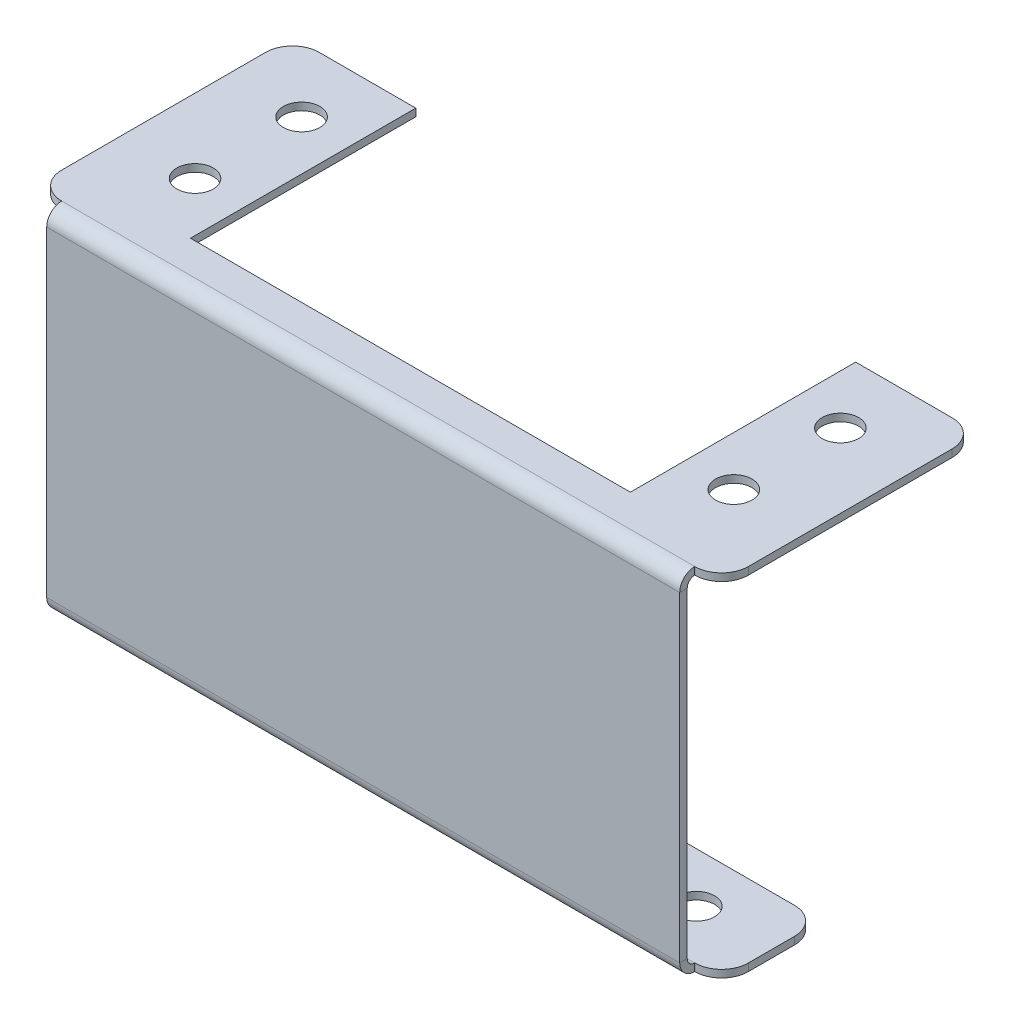
from build123d import *

# Parameters (mm, degrees)
SKETCH4_W                    = 64
SKETCH4_H                    = 24
BASE_FLANGE2_DEPTH           = 0.7
CUT_EXTRUDE1_REACH           = 36.183
SKETCH7_W                    = 41
SKETCH7_H                    = 21
CUT_EXTRUDE2_REACH           = 36.183
SKETCH8_R                    = 1.7
EDGE_FLANGE1_DEPTH           = 59
EDGE_FLANGE2_STRIP_W         = 4.2
EDGE_FLANGE2_STRIP_H         = 0.7
EDGE_FLANGE2_STRIP_CUT_DEPTH = 59
EDGE_FLANGE2_DEPTH           = 59
SKETCH16_W                   = 2.5
SKETCH16_H                   = 9.3
TAB1_DEPTH                   = 0.7
CUT_EXTRUDE3_REACH           = 49.197
SKETCH15_R                   = 1.7
BREAK_CORNER1_START          = -32.7
BREAK_CORNER1_DEPTH          = 32.7
BREAK_CORNER1_2_DEPTH        = 0.7


# Read off the part's stored shape, not the designer's step: Break-Corner1
# Sheet-metal steps are written as plain solids
with BuildPart() as part:
    # Sketch4 → Base-Flange2 (new body)
    with BuildSketch(Plane(origin=(0, 0, 0), x_dir=(1, 0, 0), z_dir=(0, 1, 0))):
        Rectangle(SKETCH4_W, SKETCH4_H)
    extrude(amount=-BASE_FLANGE2_DEPTH)

    # Sketch7 → Cut-Extrude1 (cut, up to next)
    with BuildSketch(Plane(origin=(0, 0, 0), x_dir=(1, 0, 0), z_dir=(0, 1, 0)), mode=Mode.PRIVATE) as cut_extrude1_sk1:
        with Locations((0, 1.5)):
            Rectangle(SKETCH7_W, SKETCH7_H)
    cut_extrude1_tool1 = extrude(cut_extrude1_sk1.sketch, amount=-CUT_EXTRUDE1_REACH, mode=Mode.PRIVATE) & part.part
    add(cut_extrude1_tool1.solids().sort_by_distance((0, 0, -1.5))[0], mode=Mode.SUBTRACT)

    # Sketch8 → Cut-Extrude2 (cut, up to next)
    with BuildSketch(Plane(origin=(0, 0, 0), x_dir=(1, 0, 0), z_dir=(0, 1, 0)), mode=Mode.PRIVATE) as cut_extrude2_sk1:
        with Locations(Location((-25.108, -3.9655, 0), (0, 0, 270))):
            Circle(SKETCH8_R)
    cut_extrude2_tool1 = extrude(cut_extrude2_sk1.sketch, amount=-CUT_EXTRUDE2_REACH, mode=Mode.PRIVATE) & part.part
    # Sketch8 → Cut-Extrude2 (cut, up to next)
    with BuildSketch(Plane(origin=(0, 0, 0), x_dir=(1, 0, 0), z_dir=(0, 1, 0)), mode=Mode.PRIVATE) as cut_extrude2_sk2:
        with Locations(Location((-25.108, 5.9655, 0), (0, 0, 270))):
            Circle(SKETCH8_R)
    cut_extrude2_tool2 = extrude(cut_extrude2_sk2.sketch, amount=-CUT_EXTRUDE2_REACH, mode=Mode.PRIVATE) & part.part
    # Sketch8 → Cut-Extrude2 (cut, up to next)
    with BuildSketch(Plane(origin=(0, 0, 0), x_dir=(1, 0, 0), z_dir=(0, 1, 0)), mode=Mode.PRIVATE) as cut_extrude2_sk3:
        with Locations(Location((25.108, -3.9655, 0), (0, 0, 270))):
            Circle(SKETCH8_R)
    cut_extrude2_tool3 = extrude(cut_extrude2_sk3.sketch, amount=-CUT_EXTRUDE2_REACH, mode=Mode.PRIVATE) & part.part
    # Sketch8 → Cut-Extrude2 (cut, up to next)
    with BuildSketch(Plane(origin=(0, 0, 0), x_dir=(1, 0, 0), z_dir=(0, 1, 0)), mode=Mode.PRIVATE) as cut_extrude2_sk4:
        with Locations(Location((25.108, 5.9655, 0), (0, 0, 270))):
            Circle(SKETCH8_R)
    cut_extrude2_tool4 = extrude(cut_extrude2_sk4.sketch, amount=-CUT_EXTRUDE2_REACH, mode=Mode.PRIVATE) & part.part
    add(cut_extrude2_tool1.solids().sort_by_distance((-25.108, 0, 3.9655))[0], mode=Mode.SUBTRACT)
    add(cut_extrude2_tool2.solids().sort_by_distance((-25.108, 0, -5.9655))[0], mode=Mode.SUBTRACT)
    add(cut_extrude2_tool3.solids().sort_by_distance((25.108, 0, 3.9655))[0], mode=Mode.SUBTRACT)
    add(cut_extrude2_tool4.solids().sort_by_distance((25.108, 0, -5.9655))[0], mode=Mode.SUBTRACT)

    # Edge-Flange1 section (across the edge) → Edge-Flange1 (add)
    with BuildSketch(Plane(origin=(29.5, -0.7, 12.7), x_dir=(0, 0, -1), z_dir=(-1, 0, 0))):
        with BuildLine():
            Line((-0.7, 0.7), (-0.7, 32))
            Line((-0.7, 32), (0, 32))
            Line((0, 32), (0, 0.7))
            ThreePointArc((0, 0.7), (0.205025253, 0.205025253), (0.7, 0))
            Line((0.7, 0), (0.7, -0.7))
            ThreePointArc((0.7, -0.7), (-0.289949494, -0.289949494), (-0.7, 0.7))
        make_face()
    extrude(amount=EDGE_FLANGE1_DEPTH)

    # Edge-Flange2 strip (across the edge) → Edge-Flange2 strip cut (cut)
    with BuildSketch(Plane(origin=(29.5, -32.7, 12.7), x_dir=(0, 1, 0), z_dir=(-1, 0, 0))):
        with Locations((-0.7, -0.35)):
            Rectangle(EDGE_FLANGE2_STRIP_W, EDGE_FLANGE2_STRIP_H)
    extrude(amount=EDGE_FLANGE2_STRIP_CUT_DEPTH, mode=Mode.SUBTRACT)

    # Edge-Flange2 section (across the edge) → Edge-Flange2 (add)
    with BuildSketch(Plane(origin=(29.5, -32.7, 12.7), x_dir=(0, 1, 0), z_dir=(-1, 0, 0))):
        with BuildLine():
            Line((0, 0.7), (0, 10))
            Line((0, 10), (0.7, 10))
            Line((0.7, 10), (0.7, 0.7))
            ThreePointArc((0.7, 0.7), (0.905025253, 0.205025253), (1.4, 0))
            Line((1.4, 0), (1.4, -0.7))
            ThreePointArc((1.4, -0.7), (0.410050506, -0.289949494), (0, 0.7))
        make_face()
    extrude(amount=EDGE_FLANGE2_DEPTH)

    # Sketch16 → Tab1 (add)
    with BuildSketch(Plane(origin=(0, -32, 0), x_dir=(1, 0, 0), z_dir=(0, 1, 0))):
        with Locations((-30.75, -7.35)):
            Rectangle(SKETCH16_W, SKETCH16_H)
        with Locations((30.75, -7.35)):
            Rectangle(SKETCH16_W, SKETCH16_H)
    extrude(amount=-TAB1_DEPTH)

    # Sketch15 → Cut-Extrude3 (cut, up to next)
    with BuildSketch(Plane(origin=(0, -32, 0), x_dir=(1, 0, 0), z_dir=(0, 1, 0)), mode=Mode.PRIVATE) as cut_extrude3_sk1:
        with Locations(Location((25, -7.35, 0), (0, 0, 270))):
            Circle(SKETCH15_R)
    cut_extrude3_tool1 = extrude(cut_extrude3_sk1.sketch, amount=-CUT_EXTRUDE3_REACH, mode=Mode.PRIVATE) & part.part
    # Sketch15 → Cut-Extrude3 (cut, up to next)
    with BuildSketch(Plane(origin=(0, -32, 0), x_dir=(1, 0, 0), z_dir=(0, 1, 0)), mode=Mode.PRIVATE) as cut_extrude3_sk2:
        with Locations(Location((-25, -7.35, 0), (0, 0, 90))):
            Circle(SKETCH15_R)
    cut_extrude3_tool2 = extrude(cut_extrude3_sk2.sketch, amount=-CUT_EXTRUDE3_REACH, mode=Mode.PRIVATE) & part.part
    add(cut_extrude3_tool1.solids().sort_by_distance((25, -32, 7.35))[0], mode=Mode.SUBTRACT)
    add(cut_extrude3_tool2.solids().sort_by_distance((-25, -32, 7.35))[0], mode=Mode.SUBTRACT)

    # Break-Corner1 outline → Break-Corner1 (cut)
    with BuildSketch(Plane(origin=(0, 0, 0), x_dir=(1, 0, 0), z_dir=(0, 1, 0)).offset(BREAK_CORNER1_START)):
        with BuildLine():
            Line((-32, 12), (-32, 9.501))
            ThreePointArc((-32, 9.501), (-31.268059846, 11.268059846), (-29.501, 12))
            Line((-29.501, 12), (-32, 12))
        make_face()
        with BuildLine():
            ThreePointArc((29.501, 12), (31.268059846, 11.268059846), (32, 9.501))
            Line((32, 9.501), (32, 12))
            Line((32, 12), (29.501, 12))
        make_face()
        with BuildLine():
            Line((32, -12), (32, -9.501))
            ThreePointArc((32, -9.501), (31.268059846, -11.268059846), (29.501, -12))
            Line((29.501, -12), (32, -12))
        make_face()
        with BuildLine():
            ThreePointArc((-29.501, -12), (-31.268059846, -11.268059846), (-32, -9.501))
            Line((-32, -9.501), (-32, -12))
            Line((-32, -12), (-29.501, -12))
        make_face()
    extrude(amount=BREAK_CORNER1_DEPTH, mode=Mode.SUBTRACT)

    # Break-Corner1 2 outline → Break-Corner1 2 (cut)
    with BuildSketch(Plane(origin=(0, 0, 0), x_dir=(1, 0, 0), z_dir=(0, 1, 0)).offset(BREAK_CORNER1_START)):
        with BuildLine():
            Line((32, -2.7), (29.501, -2.7))
            ThreePointArc((29.501, -2.7), (31.268059846, -3.431940154), (32, -5.199))
            Line((32, -5.199), (32, -2.7))
        make_face()
        with BuildLine():
            Line((-32, -2.7), (-32, -5.199))
            ThreePointArc((-32, -5.199), (-31.268059846, -3.431940154), (-29.501, -2.7))
            Line((-29.501, -2.7), (-32, -2.7))
        make_face()
    extrude(amount=BREAK_CORNER1_2_DEPTH, mode=Mode.SUBTRACT)


solid = part.part
